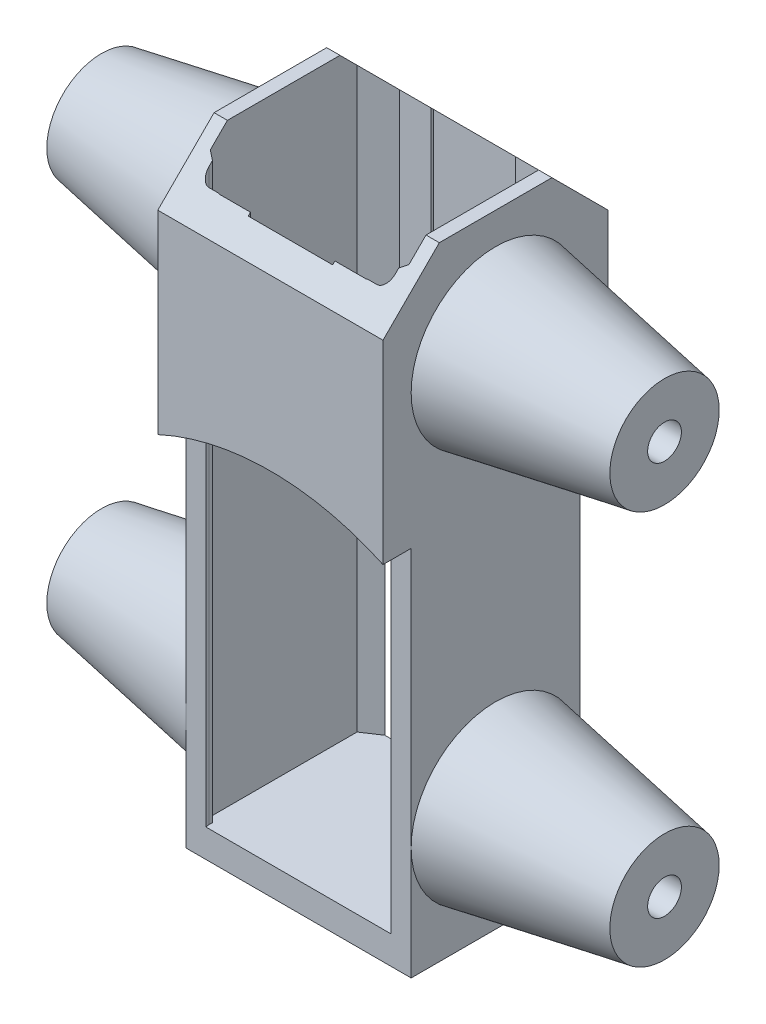
from build123d import *

# Parameters (mm, degrees)
SKETCH1_W               = 25.4
SKETCH1_H               = 25.4
BOSS_EXTRUDE1_DEPTH     = 67.056
SKETCH4_W               = 25.4
SKETCH4_H               = 25.4
BOSS_EXTRUDE4_DEPTH     = 3.175
SKETCH5_R               = 30.1625
CUT_EXTRUDE1_DEPTH      = 3.175
SKETCH7_R               = 9.525
BOSS_EXTRUDE6_DEPTH     = 19.05
BOSS_EXTRUDE6_TAPER     = 10
SKETCH8_R               = 1.905
CUT_EXTRUDE2_DEPTH      = 12.7
LPATTERN1_COUNT         = 2
LPATTERN1_PITCH         = 44.45
MIRROR2_COPY_1_SKETCH_R = 9.525
MIRROR2_COPY_1_DEPTH    = 19.05
MIRROR2_COPY_1_TAPER    = 10
MIRROR2_COPY_2_SKETCH_R = 1.905
MIRROR2_COPY_2_DEPTH    = 12.7
CHAMFER1_SIZE           = 6.35


with BuildPart() as part:
    # Sketch1 → Boss-Extrude1 (new body)
    with BuildSketch(Plane(origin=(0, 0, 0), x_dir=(1, 0, 0), z_dir=(0, 1, 0))):
        Rectangle(SKETCH1_W, SKETCH1_H)
        with BuildLine():
            Line((4.7625, -10.1854), (8.329805012, -10.1854))
            Line((8.329805012, -10.1854), (8.376905012, -10.154))
            Line((8.376905012, -10.154), (9.416515139, -10.154))
            ThreePointArc((9.416515139, -10.154), (9.501675056, -10.1507417), (9.586332782, -10.140948982))
            Line((9.586332782, -10.140948982), (9.615351798, -10.140948982))
            ThreePointArc((9.615351798, -10.140948982), (10.251622353, -9.784337345), (10.504, -9.1))
            Line((10.504, -9.1), (10.504, -8.735936675))
            Line((10.504, -8.735936675), (11.2014, -8.271003341))
            Line((11.2014, -8.271003341), (11.2014, 8.271003341))
            Line((11.2014, 8.271003341), (8.329805012, 10.1854))
            Line((8.329805012, 10.1854), (4.7625, 10.1854))
            Line((4.7625, 10.1854), (4.7625, 10.4394))
            Line((4.7625, 10.4394), (-4.7625, 10.4394))
            Line((-4.7625, 10.4394), (-4.7625, 10.1854))
            Line((-4.7625, 10.1854), (-8.329805012, 10.1854))
            Line((-8.329805012, 10.1854), (-11.2014, 8.271003341))
            Line((-11.2014, 8.271003341), (-11.2014, -8.271003341))
            Line((-11.2014, -8.271003341), (-10.504, -8.735936675))
            Line((-10.504, -8.735936675), (-10.504, -9.1))
            ThreePointArc((-10.504, -9.1), (-10.251622353, -9.784337345), (-9.615351798, -10.140948982))
            Line((-9.615351798, -10.140948982), (-9.586332782, -10.140948982))
            ThreePointArc((-9.586332782, -10.140948982), (-9.501675056, -10.1507417), (-9.416515139, -10.154))
            Line((-9.416515139, -10.154), (-8.376905012, -10.154))
            Line((-8.376905012, -10.154), (-8.329805012, -10.1854))
            Line((-8.329805012, -10.1854), (-4.7625, -10.1854))
            Line((-4.7625, -10.1854), (-4.7625, -10.4394))
            Line((-4.7625, -10.4394), (4.7625, -10.4394))
            Line((4.7625, -10.4394), (4.7625, -10.1854))
        make_face(mode=Mode.SUBTRACT)
    extrude(amount=BOSS_EXTRUDE1_DEPTH)

    # Sketch4 → Boss-Extrude4 (add)
    with BuildSketch(Plane(origin=(0, 0, 0), x_dir=(-1, 0, 0), z_dir=(0, -1, 0))):
        Rectangle(SKETCH4_W, SKETCH4_H)
    extrude(amount=BOSS_EXTRUDE4_DEPTH)

    # Sketch5 → Cut-Extrude1 (cut)
    with BuildSketch(Plane(origin=(0, 0, -12.7), x_dir=(-1, 0, 0), z_dir=(0, 0, -1))):
        with Locations((0, 11.43)):
            Circle(SKETCH5_R)
    cut_extrude1 = extrude(amount=-CUT_EXTRUDE1_DEPTH, mode=Mode.SUBTRACT)

    # Mirror1: Cut-Extrude1 across plane
    add(cut_extrude1.mirror(Plane.XY), mode=Mode.SUBTRACT)

    # Sketch7 → Boss-Extrude6 (add)
    with BuildSketch(Plane(origin=(12.7, 0, 0), x_dir=(0, 0, -1), z_dir=(1, 0, 0))):
        with Locations((0, 9.525)):
            Circle(SKETCH7_R)
    boss_extrude6 = extrude(amount=BOSS_EXTRUDE6_DEPTH, taper=BOSS_EXTRUDE6_TAPER)

    # Sketch8 → Cut-Extrude2 (cut)
    with BuildSketch(Plane(origin=(31.75, 0, 0), x_dir=(0, 0, -1), z_dir=(1, 0, 0))):
        with Locations((0, 9.525)):
            Circle(SKETCH8_R)
    cut_extrude2 = extrude(amount=-CUT_EXTRUDE2_DEPTH, mode=Mode.SUBTRACT)

    # LPattern1: Boss-Extrude6, Cut-Extrude2 ×2
    with Locations(*[(0, i * LPATTERN1_PITCH, 0) for i in range(1, LPATTERN1_COUNT)]):
        add(boss_extrude6)
        add(cut_extrude2, mode=Mode.SUBTRACT)

    # Mirror2: Boss-Extrude6, Cut-Extrude2 across plane
    add(boss_extrude6.mirror(Plane(origin=(0, 0, 0), x_dir=(0, 0, 1), z_dir=(1, 0, 0))))
    add(cut_extrude2.mirror(Plane(origin=(0, 0, 0), x_dir=(0, 0, 1), z_dir=(1, 0, 0))), mode=Mode.SUBTRACT)

    # Mirror2 copy 1 sketch → Mirror2 copy 1 (add)
    with BuildSketch(Plane(origin=(-12.7, 44.45, 0), x_dir=(0, 0, -1), z_dir=(-1, 0, 0))):
        with Locations((0, -9.525)):
            Circle(MIRROR2_COPY_1_SKETCH_R)
    extrude(amount=MIRROR2_COPY_1_DEPTH, taper=MIRROR2_COPY_1_TAPER)

    # Mirror2 copy 2 sketch → Mirror2 copy 2 (cut)
    with BuildSketch(Plane(origin=(-31.75, 44.45, 0), x_dir=(0, 0, -1), z_dir=(-1, 0, 0))):
        with Locations((0, -9.525)):
            Circle(MIRROR2_COPY_2_SKETCH_R)
    extrude(amount=-MIRROR2_COPY_2_DEPTH, mode=Mode.SUBTRACT)

    # Chamfer1
    # the kernel refuses this chamfer: 6.35 mm, written as the material it takes off along each edge
    with BuildSketch(Plane(origin=(-29.030186974, 67.056, 12.7), x_dir=(0, -0.9996219169112968, 0.027495876610586455), z_dir=(1, 0, 0))) as chamfer1_piece_1:
        Polygon((CHAMFER1_SIZE * 0.999621916911, CHAMFER1_SIZE * 0.0274958766106), (-CHAMFER1_SIZE * 0.0274958766106, CHAMFER1_SIZE * 0.999621916911), (0, 0), align=None)
    extrude(amount=58.060373947, mode=Mode.SUBTRACT)
    with BuildSketch(Plane(origin=(29.030186974, 67.056, -12.7), x_dir=(0, 0.027495876610585654, 0.9996219169112966), z_dir=(-1, 0, 0))) as chamfer1_piece_2:
        Polygon((CHAMFER1_SIZE * 0.999621916911, -CHAMFER1_SIZE * 0.0274958766106), (-CHAMFER1_SIZE * 0.0274958766106, -CHAMFER1_SIZE * 0.999621916911), (0, 0), align=None)
    extrude(amount=58.060373947, mode=Mode.SUBTRACT)


solid = part.part
